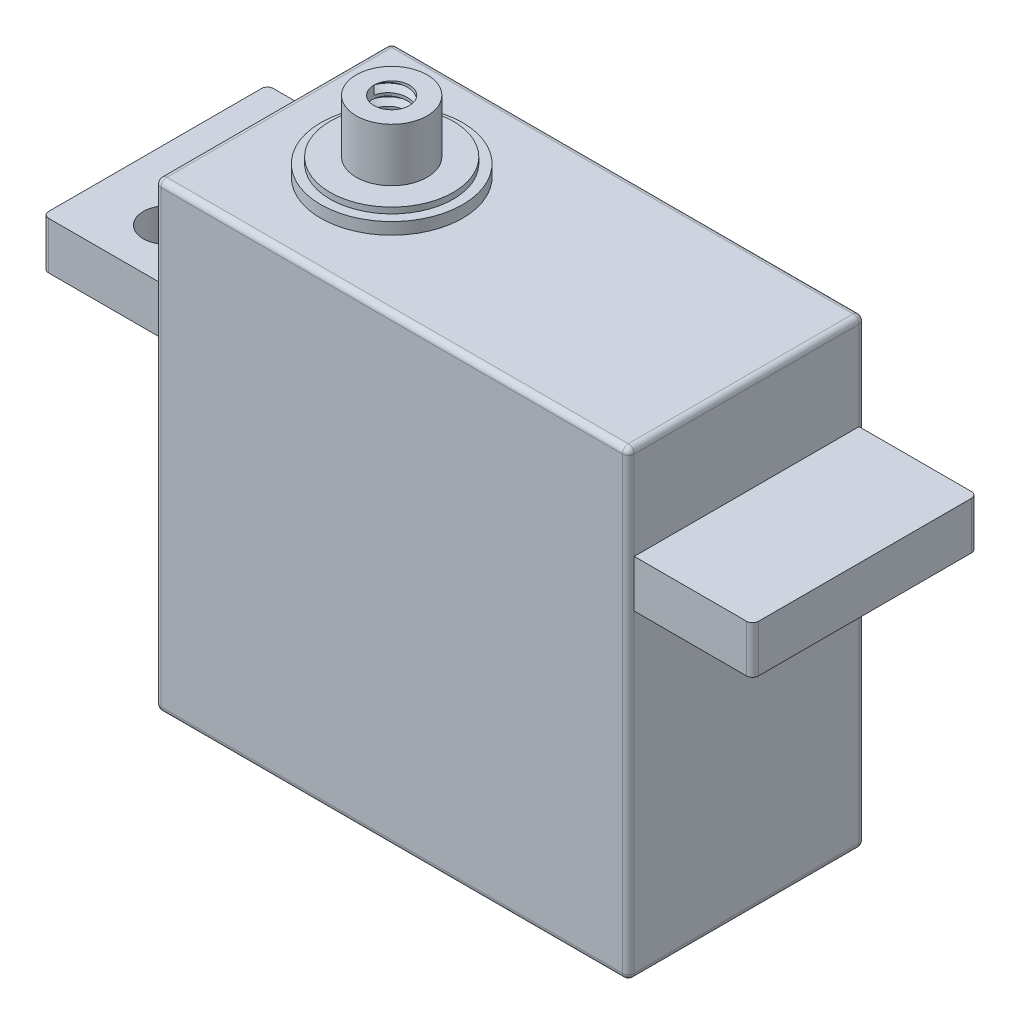
from build123d import *
from build123d.topology import SkipClean

# Parameters (mm, degrees)
SKETCH_1_W          = 40
SKETCH_1_H          = 39
EXTRUDE_1_DEPTH     = 20
SKETCH_2_W          = 19
SKETCH_2_H          = 4
EXTRUDE_2_DEPTH     = 10
SKETCH_3_W          = 19
SKETCH_3_H          = 4
EXTRUDE_3_DEPTH     = 10
SKETCH_6_R          = 6
EXTRUDE_4_DEPTH     = 1
SKETCH_7_R          = 5.208208
EXTRUDE_5_DEPTH     = 0.5
SKETCH_8_R          = 3
EXTRUDE_6_DEPTH     = 4.5
SKETCH_9_R          = 1.5
CUT_EXTRUDE_3_DEPTH = 4.5
THREAD_1_PITCH      = 1
FILLET_1_R          = 0.5
FILLET_2_R          = 0.5
FILLET_7_R          = 0.5
FILLET_8_R          = 0.5
FILLET_15_R         = 0.5
SKETCH_16_R         = 2
CUT_EXTRUDE_4_DEPTH = 4.5
FILLET_16_R         = 0.5
FILLET_17_R         = 0.5
FILLET_18_R         = 0.5
FILLET_19_R         = 0.5


with BuildPart() as part:
    # Sketch 1 → 凸台-拉伸1 (new body)
    with BuildSketch(Plane.XY):
        with Locations((20, -19.5)):
            Rectangle(SKETCH_1_W, SKETCH_1_H)
    extrude(amount=EXTRUDE_1_DEPTH)

    # 草图2 → 凸台-拉伸2 (add)
    with BuildSketch(Plane.ZY):
        with Locations((10, -10)):
            Rectangle(SKETCH_2_W, SKETCH_2_H)
    extrude(amount=EXTRUDE_2_DEPTH)

    # 草图3 → 凸台-拉伸3 (add)
    with BuildSketch(Plane(origin=(40, 0, 0), x_dir=(0, 0, -1), z_dir=(1, 0, 0))):
        with Locations((-10, -10)):
            Rectangle(SKETCH_3_W, SKETCH_3_H)
    extrude(amount=EXTRUDE_3_DEPTH)

    # 草图6 → 凸台-拉伸4 (add)
    with BuildSketch(Plane(origin=(0, 0, 0), x_dir=(1, 0, 0), z_dir=(0, 1, 0))):
        with Locations(Location((10, -10, 0), (0, 0, 90))):
            Circle(SKETCH_6_R)
    extrude(amount=EXTRUDE_4_DEPTH)

    # 草图7 → 凸台-拉伸5 (add)
    with BuildSketch(Plane(origin=(0, 1, 0), x_dir=(1, 0, 0), z_dir=(0, 1, 0))):
        with Locations(Location((10, -10, 0), (0, 0, 270))):
            Circle(SKETCH_7_R)
    extrude(amount=EXTRUDE_5_DEPTH)

    # 草图8 → 凸台-拉伸6 (add)
    with BuildSketch(Plane(origin=(0, 1.5, 0), x_dir=(1, 0, 0), z_dir=(0, 1, 0))):
        with Locations(Location((10, -10, 0), (0, 0, 270))):
            Circle(SKETCH_8_R)
    extrude(amount=EXTRUDE_6_DEPTH)

    # 草图9 → 切除-拉伸3 (cut)
    with BuildSketch(Plane(origin=(0, 6, 0), x_dir=(1, 0, 0), z_dir=(0, 1, 0))):
        with Locations(Location((10, -10, 0), (0, 0, 270))):
            Circle(SKETCH_9_R)
    extrude(amount=-CUT_EXTRUDE_3_DEPTH, mode=Mode.SUBTRACT)

    # 螺纹线1: the profile of Sketch 1 2 profile screwed along a right-hand helix of 4.5 turns, 8 arcs to a turn; built about Z, then put on its axis
    with SkipClean():  # the faces are left unmerged after this step: merging them gives an invalid solid
        thread_1_z = Axis((0, 0, 0), (0, 0, 1))
        thread_1_corners = [(1.4997, 0, -0.000173), (2.041266, 0, 0.3125), (2.041266, 0, 0.4375), (1.4997, 0, 0.750173)]
        with BuildLine(mode=Mode.PRIVATE) as thread_1_profile:
            Line(thread_1_corners[0], thread_1_corners[1])
            Line(thread_1_corners[1], thread_1_corners[2])
            Line(thread_1_corners[2], thread_1_corners[3])
            Line(thread_1_corners[3], thread_1_corners[0])
        thread_1_cap = Face(thread_1_profile.wire())
        thread_1_turn_angles = [0, 22.5, 45, 67.5, 90, 112.5, 135, 157.5, 180, 202.5, 225, 247.5, 270, 292.5, 315, 337.5, 360]
        thread_1_turn_weights = [1, 0.9238795325112867, 1, 0.9238795325112867, 1, 0.9238795325112867, 1, 0.9238795325112867, 1, 0.9238795325112867, 1, 0.9238795325112867, 1, 0.9238795325112867, 1, 0.9238795325112867, 1]
        thread_1_turn_rails = [Edge.make_bspline([Vector(p[0], p[1], 0).rotate(thread_1_z, thread_1_turn_angles[k]) / thread_1_turn_weights[k] + Vector(0, 0, p[2] + THREAD_1_PITCH * thread_1_turn_angles[k] / 360) for k in range(17)], [0, 0, 0, 1, 1, 2, 2, 3, 3, 4, 4, 5, 5, 6, 6, 7, 7, 8, 8, 8], 2, thread_1_turn_weights) for p in thread_1_corners]
        thread_1_turn_sides = [Face.make_surface_from_curves(thread_1_turn_rails[p[0]], thread_1_turn_rails[p[1]]) for p in [(0, 1), (1, 2), (2, 3), (3, 0)]]
        thread_1_last_angles = [1440, 1462.5, 1485, 1507.5, 1530, 1552.5, 1575, 1597.5, 1620]
        thread_1_last_weights = [1, 0.9238795325112867, 1, 0.9238795325112867, 1, 0.9238795325112867, 1, 0.9238795325112867, 1]
        thread_1_last_rails = [Edge.make_bspline([Vector(p[0], p[1], 0).rotate(thread_1_z, thread_1_last_angles[k]) / thread_1_last_weights[k] + Vector(0, 0, p[2] + THREAD_1_PITCH * thread_1_last_angles[k] / 360) for k in range(9)], [0, 0, 0, 1, 1, 2, 2, 3, 3, 4, 4, 4], 2, thread_1_last_weights) for p in thread_1_corners]
        thread_1_last_sides = [Face.make_surface_from_curves(thread_1_last_rails[p[0]], thread_1_last_rails[p[1]]) for p in [(0, 1), (1, 2), (2, 3), (3, 0)]]
        thread_1 = Plane(origin=(10, 6, 10), x_dir=(-1, 0, 0), z_dir=(0, -1, 0)) * Solid(Shell([*[p.moved(Location((0, 0, THREAD_1_PITCH * i))) for i in range(4) for p in thread_1_turn_sides], *thread_1_last_sides, thread_1_cap, thread_1_cap.rotate(thread_1_z, 1620).moved(Location((0, 0, THREAD_1_PITCH * 1620 / 360)))]))
        add(thread_1, mode=Mode.SUBTRACT)

    # 圆角1
    fillet_1_edges = [part.edges().sort_by_distance(p)[0] for p in [
        (20, 0, 20),
    ]]
    fillet(fillet_1_edges, radius=FILLET_1_R)

    # 圆角2
    fillet_2_edges = [part.edges().sort_by_distance(p)[0] for p in [
        (20, 0, 0),
    ]]
    fillet(fillet_2_edges, radius=FILLET_2_R)

    # 圆角7
    fillet_7_edges = [part.edges().sort_by_distance(p)[0] for p in [
        (0, -19.75, 20),
        (0, 0, 10),
        (0, -0.146447, 19.853553),
        (0, -19.75, 0),
        (0, -0.146447, 0.146447),
    ]]
    fillet(fillet_7_edges, radius=FILLET_7_R - 0.0001)  # a hair under: the kernel refuses the full size

    # 圆角8
    fillet_8_edges = [part.edges().sort_by_distance(p)[0] for p in [
        (40, -19.75, 20),
        (40, -19.75, 0),
        (40, 0, 10),
        (40, -0.146447, 19.853553),
        (40, -0.146447, 0.146447),
    ]]
    fillet(fillet_8_edges, radius=FILLET_8_R - 0.0001)  # a hair under: the kernel refuses the full size

    # 圆角15
    fillet_15_edges = [part.edges().sort_by_distance(p)[0] for p in [
        (40, -39, 10),
        (39.853583, -39, 0.146417),
        (39.853583, -39, 19.853583),
        (20, -39, 20),
        (20, -39, 0),
        (0, -39, 10),
        (0.146417, -39, 0.146417),
        (0.146417, -39, 19.853583),
    ]]
    fillet(fillet_15_edges, radius=FILLET_15_R - 0.0001)  # a hair under: the kernel refuses the full size

    # 草图16 → 切除-拉伸4 (cut)
    with SkipClean():  # the faces are left unmerged after this step: merging them gives an invalid solid
        with BuildSketch(Plane(origin=(0, -8, 0), x_dir=(1, 0, 0), z_dir=(0, 1, 0))):
            with Locations(Location((-4, -5, 0), (0, 0, 270))):
                Circle(SKETCH_16_R)
            with Locations(Location((-4, -15, 0), (0, 0, 270))):
                Circle(SKETCH_16_R)
        extrude(amount=-CUT_EXTRUDE_4_DEPTH, mode=Mode.SUBTRACT)

    # 圆角16
    fillet_16_edges = [part.edges().sort_by_distance(p)[0] for p in [
        (-10, -10, 19.5),
    ]]
    fillet(fillet_16_edges, radius=FILLET_16_R)

    # 圆角17
    fillet_17_edges = [part.edges().sort_by_distance(p)[0] for p in [
        (-10, -10, 0.5),
    ]]
    fillet(fillet_17_edges, radius=FILLET_17_R)

    # 圆角18
    fillet_18_edges = [part.edges().sort_by_distance(p)[0] for p in [
        (50, -10, 19.5),
    ]]
    fillet(fillet_18_edges, radius=FILLET_18_R)

    # 圆角19
    fillet_19_edges = [part.edges().sort_by_distance(p)[0] for p in [
        (50, -10, 0.5),
    ]]
    fillet(fillet_19_edges, radius=FILLET_19_R)


solid = part.part
